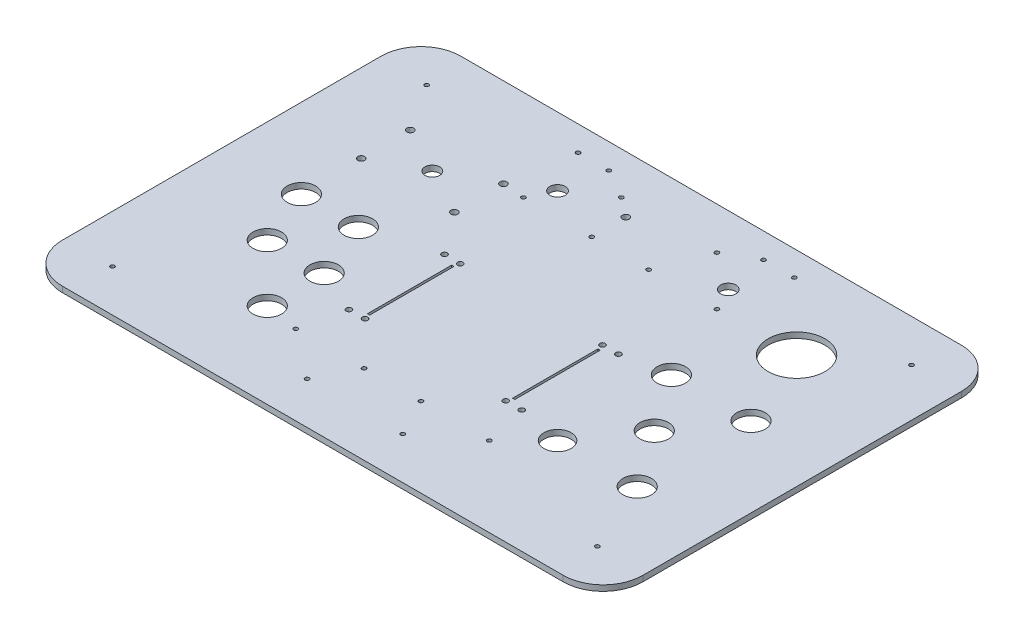
from build123d import *

# Parameters (mm, degrees)
SKETCH1_W               = 510
SKETCH1_H               = 350
BOSS_EXTRUDE1_DEPTH     = 5
SKETCH2_R               = 6.5
SKETCH2_R_2             = 3
F_1_JOYYSTICK_DEPTH     = 619.566892098
SKETCH3_R               = 12.5
F_1_BUTTONS_DEPTH       = 619.566892098
SKETCH4_R               = 6.75
F_1_ROCKET_SWITCH_DEPTH = 619.566892098
SKETCH5_R               = 2.4
SKETCH5_W               = 2
SKETCH5_H               = 74
F_1_POTENTIOMETER_DEPTH = 619.566892098
FILLET1_R               = 35
SKETCH6_R               = 12.5
SKETCH6_R_2             = 12
F_2_BUTTONS_DEPTH       = 619.566892098
SKETCH9_R               = 25
F_2_SPEAKER_DEPTH       = 619.566892098
SKETCH10_R              = 6.75
F_2_ROCKET_SWITCH_DEPTH = 619.566892098
SKETCH8_R               = 2.4
SKETCH8_W               = 2
SKETCH8_H               = 75
F_2_POTENTIOMETER_DEPTH = 619.566892098
SKETCH11_R              = 1.8
F_2_PCB1_DEPTH          = 619.566892098
SKETCH12_R              = 1.8
F_1_PCB2_DEPTH          = 619.566892098
SKETCH13_R              = 1.8
F_2_USB_CONNECTOR_DEPTH = 619.566892098
SKETCH14_R              = 1.8
F_1_USB_CONNECTOR_DEPTH = 619.566892098
SKETCH15_R              = 3
POWER_DEPTH             = 619.566892098
SKETCH16_R              = 1.8
LED_FIXINGS_DEPTH       = 619.566892098


with BuildPart() as part:
    # Sketch1 → Boss-Extrude1 (new body)
    with BuildSketch(Plane(origin=(0, 0, 0), x_dir=(1, 0, 0), z_dir=(0, 1, 0))):
        with Locations((255, 175)):
            Rectangle(SKETCH1_W, SKETCH1_H)
    extrude(amount=BOSS_EXTRUDE1_DEPTH)

    # Sketch2 → 1 Joyystick (cut, through all)
    with BuildSketch(Plane(origin=(0, 5, 0), x_dir=(1, 0, 0), z_dir=(0, 1, 0))):
        with Locations((110, 250)):
            Circle(SKETCH2_R)
        with Locations((150.91, 271.59)):
            Circle(SKETCH2_R_2)
        with Locations((150.91, 228.41)):
            Circle(SKETCH2_R_2)
        with Locations((69.09, 228.41)):
            Circle(SKETCH2_R_2)
        with Locations((69.09, 271.59)):
            Circle(SKETCH2_R_2)
    extrude(amount=-F_1_JOYYSTICK_DEPTH, mode=Mode.SUBTRACT)

    # Sketch3 → 1 Buttons (cut, through all)
    with BuildSketch(Plane(origin=(0, 5, 0), x_dir=(1, 0, 0), z_dir=(0, 1, 0))):
        with Locations((70, 175)):
            Circle(SKETCH3_R)
        with Locations((120, 175)):
            Circle(SKETCH3_R)
        with Locations((90, 125)):
            Circle(SKETCH3_R)
        with Locations((140, 125)):
            Circle(SKETCH3_R)
        with Locations((140, 75)):
            Circle(SKETCH3_R)
    extrude(amount=-F_1_BUTTONS_DEPTH, mode=Mode.SUBTRACT)

    # Sketch4 → 1 Rocket Switch (cut, through all)
    with BuildSketch(Plane(origin=(0, 5, 0), x_dir=(1, 0, 0), z_dir=(0, 1, 0))):
        with Locations((180, 290)):
            Circle(SKETCH4_R)
    extrude(amount=-F_1_ROCKET_SWITCH_DEPTH, mode=Mode.SUBTRACT)

    # Sketch5 → 1 Potentiometer (cut, through all)
    with BuildSketch(Plane(origin=(0, 5, 0), x_dir=(1, 0, 0), z_dir=(0, 1, 0))):
        with Locations((178.719749064, 192)):
            Circle(SKETCH5_R)
        with Locations((192.718338039, 191.801237073)):
            Circle(SKETCH5_R)
        with Locations((192.718338039, 108.198762927)):
            Circle(SKETCH5_R)
        with Locations((178.719749064, 108)):
            Circle(SKETCH5_R)
        with Locations((191, 150)):
            Rectangle(SKETCH5_W, SKETCH5_H)
    extrude(amount=-F_1_POTENTIOMETER_DEPTH, mode=Mode.SUBTRACT)

    # Fillet1
    fillet1_edges = [part.edges().sort_by_distance(p)[0] for p in [
        (0, 2.5, 0),
        (510, 2.5, 0),
        (510, 2.5, -350),
        (0, 2.5, -350),
    ]]
    fillet(fillet1_edges, radius=FILLET1_R)

    # Sketch6 → 2 Buttons (cut, through all)
    with BuildSketch(Plane(origin=(0, 5, 0), x_dir=(1, 0, 0), z_dir=(0, 1, 0))):
        with Locations((440, 200)):
            Circle(SKETCH6_R)
        with Locations((370, 200)):
            Circle(SKETCH6_R)
        with Locations((440, 100)):
            Circle(SKETCH6_R)
        with Locations((370, 100)):
            Circle(SKETCH6_R_2)
        with Locations((405, 150)):
            Circle(SKETCH6_R)
    extrude(amount=-F_2_BUTTONS_DEPTH, mode=Mode.SUBTRACT)

    # Sketch9 → 2 speaker (cut, through all)
    with BuildSketch(Plane(origin=(0, 5, 0), x_dir=(1, 0, 0), z_dir=(0, 1, 0))):
        with Locations((410, 270)):
            Circle(SKETCH9_R)
    extrude(amount=-F_2_SPEAKER_DEPTH, mode=Mode.SUBTRACT)

    # Sketch10 → 2 Rocket Switch (cut, through all)
    with BuildSketch(Plane(origin=(0, 5, 0), x_dir=(1, 0, 0), z_dir=(0, 1, 0))):
        with Locations((330, 290)):
            Circle(SKETCH10_R)
    extrude(amount=-F_2_ROCKET_SWITCH_DEPTH, mode=Mode.SUBTRACT)

    # Sketch8 → 2 Potentiometer (cut, through all)
    with BuildSketch(Plane(origin=(0, 5, 0), x_dir=(1, 0, 0), z_dir=(0, 1, 0))):
        with Locations((331, 192.5)):
            Circle(SKETCH8_R)
        with Locations((331, 107.5)):
            Circle(SKETCH8_R)
        with Locations((317, 107.5)):
            Circle(SKETCH8_R)
        with Locations((317, 192.5)):
            Circle(SKETCH8_R)
        with Locations((319, 150)):
            Rectangle(SKETCH8_W, SKETCH8_H)
    extrude(amount=-F_2_POTENTIOMETER_DEPTH, mode=Mode.SUBTRACT)

    # Sketch11 → 2 PCB1 (cut, through all)
    with BuildSketch(Plane(origin=(0, 5, 0), x_dir=(1, 0, 0), z_dir=(0, 1, 0))):
        with Locations((340, 70)):
            Circle(SKETCH11_R)
        with Locations((280, 70)):
            Circle(SKETCH11_R)
        with Locations((280, 270)):
            Circle(SKETCH11_R)
        with Locations((340, 270)):
            Circle(SKETCH11_R)
    extrude(amount=-F_2_PCB1_DEPTH, mode=Mode.SUBTRACT)

    # Sketch12 → 1 PCB2 (cut, through all)
    with BuildSketch(Plane(origin=(0, 5, 0), x_dir=(1, 0, 0), z_dir=(0, 1, 0))):
        with Locations((230, 70)):
            Circle(SKETCH12_R)
        with Locations((170, 70)):
            Circle(SKETCH12_R)
        with Locations((230, 270)):
            Circle(SKETCH12_R)
        with Locations((170, 270)):
            Circle(SKETCH12_R)
    extrude(amount=-F_1_PCB2_DEPTH, mode=Mode.SUBTRACT)

    # Sketch13 → 2 USB Connector (cut, through all)
    with BuildSketch(Plane(origin=(0, 5, 0), x_dir=(1, 0, 0), z_dir=(0, 1, 0))):
        with Locations((350, 328)):
            Circle(SKETCH13_R)
        with Locations((323, 328)):
            Circle(SKETCH13_R)
    extrude(amount=-F_2_USB_CONNECTOR_DEPTH, mode=Mode.SUBTRACT)

    # Sketch14 → 1 USB Connector (cut, through all)
    with BuildSketch(Plane(origin=(0, 5, 0), x_dir=(1, 0, 0), z_dir=(0, 1, 0))):
        with Locations((187, 328)):
            Circle(SKETCH14_R)
        with Locations((160, 328)):
            Circle(SKETCH14_R)
    extrude(amount=-F_1_USB_CONNECTOR_DEPTH, mode=Mode.SUBTRACT)

    # Sketch15 → Power (cut, through all)
    with BuildSketch(Plane(origin=(0, 5, 0), x_dir=(1, 0, 0), z_dir=(0, 1, 0))):
        with Locations((230, 300)):
            Circle(SKETCH15_R)
    extrude(amount=-POWER_DEPTH, mode=Mode.SUBTRACT)

    # Sketch16 → LED fixings (cut, through all)
    with BuildSketch(Plane(origin=(0, 5, 0), x_dir=(1, 0, 0), z_dir=(0, 1, 0))):
        with Locations((468, 37)):
            Circle(SKETCH16_R)
        with Locations((297, 37)):
            Circle(SKETCH16_R)
        with Locations((468, 313)):
            Circle(SKETCH16_R)
        with Locations((297, 313)):
            Circle(SKETCH16_R)
        with Locations((213, 313)):
            Circle(SKETCH16_R)
        with Locations((42, 313)):
            Circle(SKETCH16_R)
        with Locations((213, 37)):
            Circle(SKETCH16_R)
        with Locations((42, 37)):
            Circle(SKETCH16_R)
    extrude(amount=-LED_FIXINGS_DEPTH, mode=Mode.SUBTRACT)


solid = part.part
